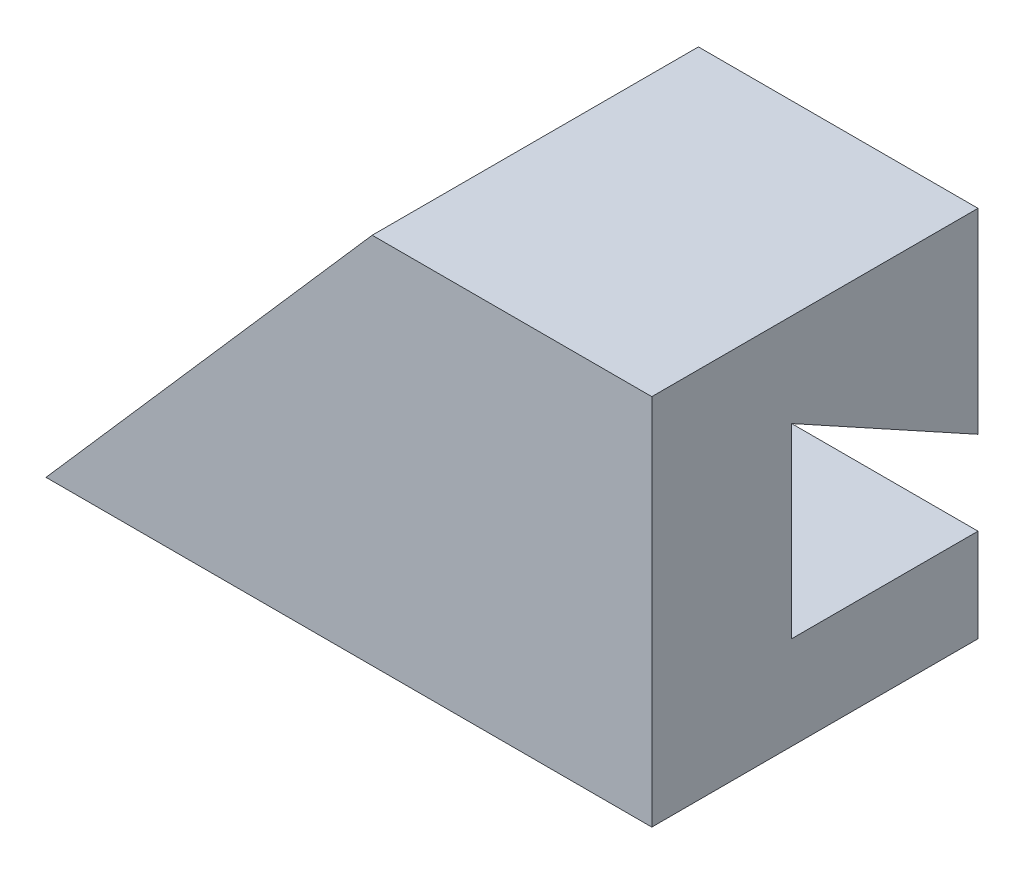
from build123d import *

# Parameters (mm, degrees)
BOSS_EXTRU_1_DEPTH = 65
CHANFREIN1_SIZE2   = 40
CHANFREIN1_SIZE    = 35


with BuildPart() as part:
    # Esquisse1 → Boss.-Extru.1 (new body)
    with BuildSketch(Plane(origin=(0, 0, 0), x_dir=(0, 0, -1), z_dir=(1, 0, 0))):
        Polygon((-21.204724929, -24.063055062), (13.795275071, -24.063055062), (13.795275071, -14.063055062), (-6.204724929, -14.063055062), (-6.204724929, 5.936944938), (13.795275071, -5.063055062), (13.795275071, 15.936944938), (-21.204724929, 15.936944938), align=None)
    extrude(amount=BOSS_EXTRU_1_DEPTH)

    # Chanfrein1
    chanfrein1_edges = [part.edges().sort_by_distance(p)[0] for p in [
        (0, 15.936944938, 3.704724929),
    ]]
    chanfrein1_side = [part.faces().sort_by_distance(p)[0] for p in [
        (0.7, 15.936944938, 3.704724929),
    ]]
    chamfer(chanfrein1_edges, length=CHANFREIN1_SIZE - 0.0001, length2=CHANFREIN1_SIZE2 - 0.0001, reference=chanfrein1_side[0])  # a hair under: the kernel refuses the full size


solid = part.part
